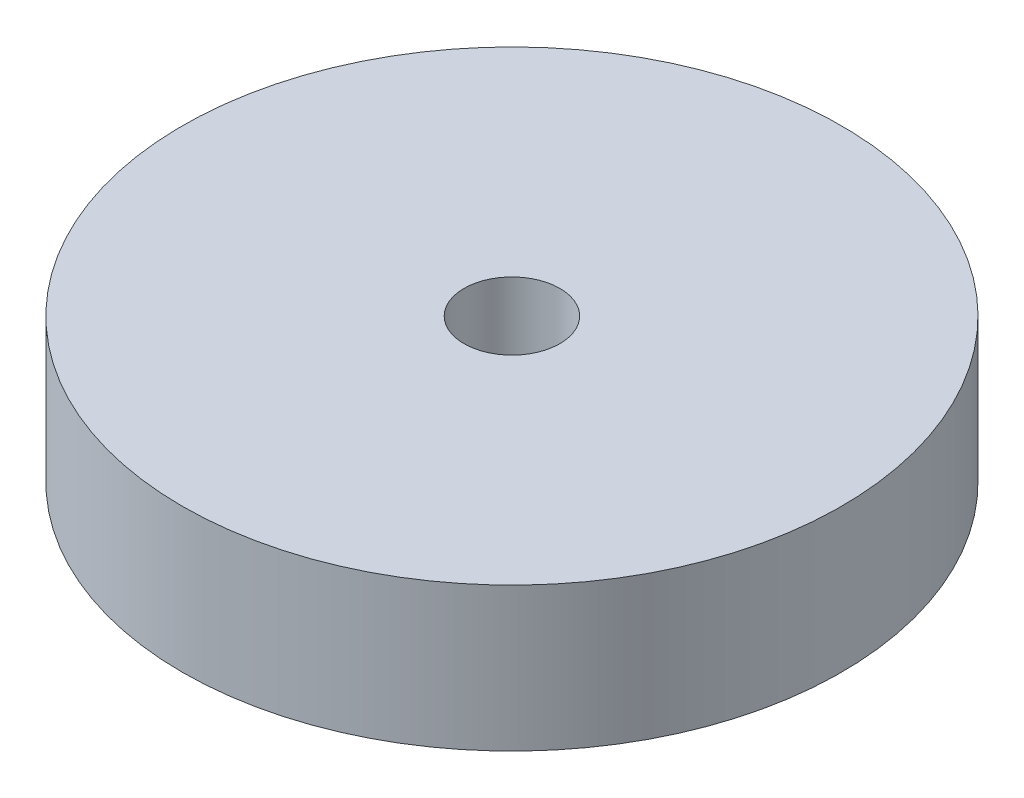
from build123d import *

# Parameters (mm, degrees)
SKETCH1_R              = 34.384
BOSS_EXTRUDE1_DEPTH    = 15
F_10_0MM_DOWEL_HOLE1_D = 10
CUT_EXTRUDE1_DEPTH     = 7.5


with BuildPart() as part:
    # Sketch1 → Boss-Extrude1 (new body)
    with BuildSketch(Plane(origin=(0, 0, 0), x_dir=(1, 0, 0), z_dir=(0, 1, 0))):
        Circle(SKETCH1_R)
    extrude(amount=BOSS_EXTRUDE1_DEPTH)

    # Ø10.0mm Dowel Hole1 (through all)
    with Locations(Plane(origin=(0, 0, 0), x_dir=(-1, 0, 0), z_dir=(0, -1, 0))):
        with Locations((0, 0)):
            Hole(F_10_0MM_DOWEL_HOLE1_D / 2)

    # Sketch4 → Cut-Extrude1 (cut)
    with BuildSketch(Plane(origin=(0, 0, 0), x_dir=(-1, 0, 0), z_dir=(0, -1, 0))):
        Polygon((-3.897114317, -6.75), (3.897114317, -6.75), (7.794228634, 0), (3.897114317, 6.75), (-3.897114317, 6.75), (-7.794228634, 0), align=None)
    extrude(amount=-CUT_EXTRUDE1_DEPTH, mode=Mode.SUBTRACT)


solid = part.part
